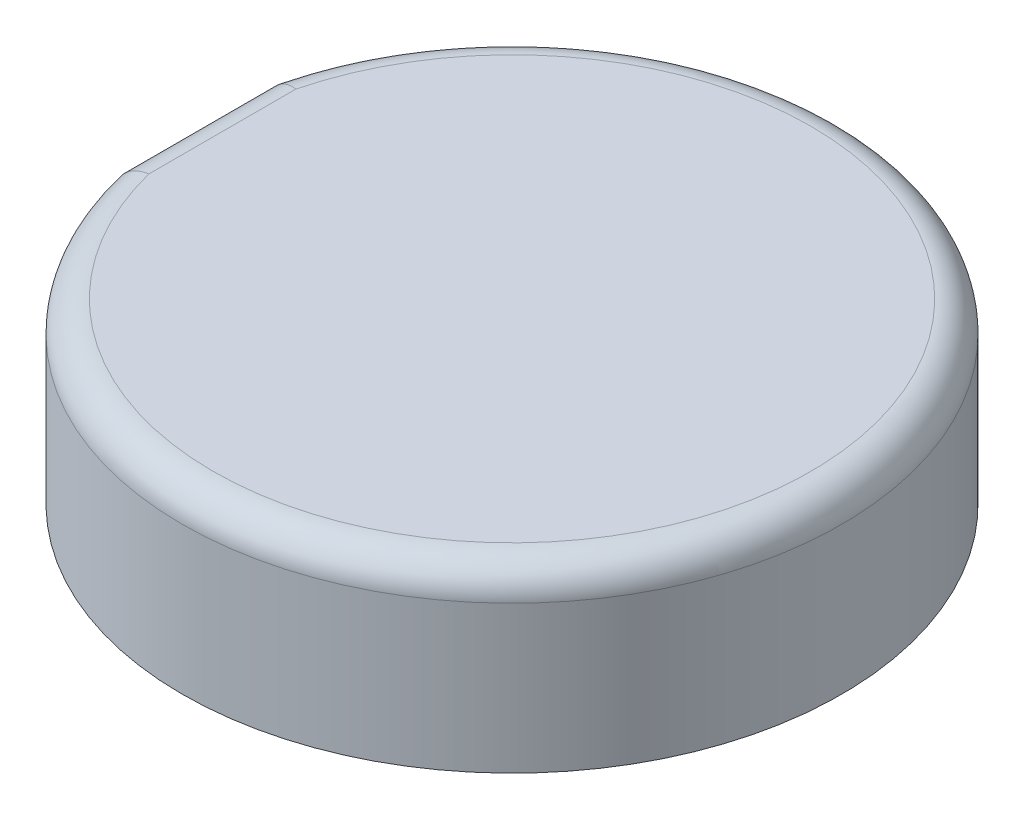
from build123d import *

# Parameters (mm, degrees)
BOSS_EXTRU_1_DEPTH = 5.8
CONG_1_R           = 1


with BuildPart() as part:
    # Esquisse1 → Boss.-Extru.1 (new body)
    with BuildSketch(Plane(origin=(0, 0, 0), x_dir=(1, 0, 0), z_dir=(0, 1, 0))):
        with BuildLine():
            Line((-10.449999999999998, -2.521904042583706), (-10.449999999999998, 2.5219040425837056))
            ThreePointArc((-10.449999999999998, 2.5219040425837056), (10.75, 0), (-10.449999999999998, -2.521904042583706))
        make_face()
    extrude(amount=BOSS_EXTRU_1_DEPTH)

    # Congé1
    # the kernel refuses this fillet: 1 mm, written as the material it takes off along each edge
    with BuildSketch(Plane(origin=(4.2e-16, 5.8, 8.22e-15), x_dir=(-0.9999956130716774, 0, -0.0029620664070946516), z_dir=(-0.0029620664070946516, 0, 0.9999956130716774))) as cong_1_piece_1:
        with BuildLine():
            CenterArc((10.750000000000002 - CONG_1_R, CONG_1_R), CONG_1_R, 270, 90)
            Line((10.750000000000002 - CONG_1_R, 0), (10.750000000000002, 0))
            Line((10.750000000000002, 0), (10.750000000000002, CONG_1_R))
        make_face()
    revolve(axis=Axis((4.2e-16, 5.8, 8.22e-15), (0, -1, 0)), revolution_arc=359.66057169612264, mode=Mode.SUBTRACT)
    with BuildSketch(Plane(origin=(-10.449999999999998, 5.8, 5.0219040425837065), x_dir=(0, -1, 0), z_dir=(0, 0, -1))) as cong_1_piece_2:
        with BuildLine():
            CenterArc((CONG_1_R, -CONG_1_R), CONG_1_R, 90, 90)
            Line((0, -CONG_1_R), (0, 0))
            Line((0, 0), (CONG_1_R, 0))
        make_face()
    extrude(amount=10.043808085167411, mode=Mode.SUBTRACT)


solid = part.part
